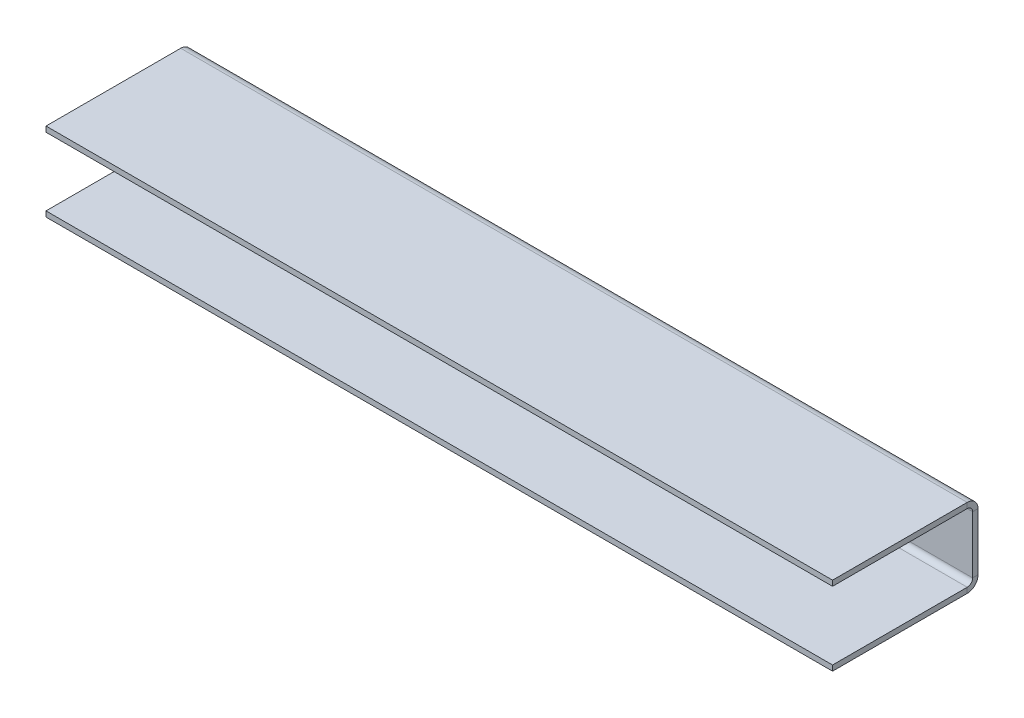
from build123d import *

# Parameters (mm, degrees)
BASE_FLANGE1_DEPTH = 463.55


# Sheet-metal steps are written as plain solids
with BuildPart() as part:
    # Sketch1 → Base-Flange1 (new body)
    with BuildSketch(Plane(origin=(0, 0, 0), x_dir=(0, 0, -1), z_dir=(1, 0, 0))):
        with BuildLine():
            Line((0, 0), (79.375, 0))
            ThreePointArc((79.375, 0), (81.62006403, 0.92993597), (82.55, 3.175))
            Line((82.55, 3.175), (82.55, 36.957))
            ThreePointArc((82.55, 36.957), (81.62006403, 39.20206403), (79.375, 40.132))
            Line((79.375, 40.132), (0, 40.132))
            Line((0, 40.132), (0, 43.307))
            Line((0, 43.307), (79.375, 43.307))
            ThreePointArc((79.375, 43.307), (83.865128061, 41.447128061), (85.725, 36.957))
            Line((85.725, 36.957), (85.725, 3.175))
            ThreePointArc((85.725, 3.175), (83.865128061, -1.315128061), (79.375, -3.175))
            Line((79.375, -3.175), (0, -3.175))
            Line((0, -3.175), (0, 0))
        make_face()
    extrude(amount=BASE_FLANGE1_DEPTH)


solid = part.part
